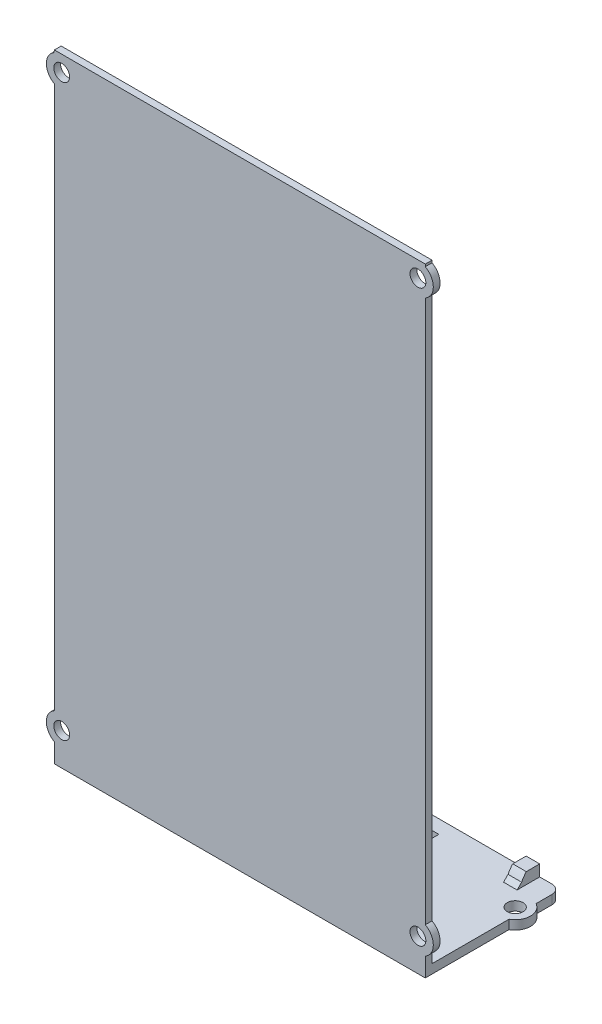
from build123d import *

# Parameters (mm, degrees)
SKETCH1_R                = 1.75
BOSS_EXTRUDE1_DEPTH      = 1.5
BOSS_EXTRUDE2_DEPTH      = 82
BOSS_EXTRUDE3_DEPTH      = 1.5
BOSS_EXTRUDE3_DEPTH_BACK = 1.5
BOSS_EXTRUDE4_DEPTH      = 2
SKETCH5_R                = 1.75
CUT_EXTRUDE1_DEPTH       = 2
CUT_EXTRUDE2_DEPTH       = 149.716477315
CUT_EXTRUDE2_DEPTH_BACK  = 149.716477315
SKETCH6_W                = 82
SKETCH6_H                = 11.5
BOSS_EXTRUDE6_START      = -2
SKETCH7_W                = 3
SKETCH7_H                = 4
BOSS_EXTRUDE6_DEPTH      = 2.5
FILLET1_R                = 2
CHAMFER1_SIZE            = 1
FILLET2_R                = 8
SKETCH8_W                = 26
SKETCH8_H                = 23
CUT_EXTRUDE3_DEPTH       = 22.4262221


with BuildPart() as part:
    # Sketch1 → Boss-Extrude1 (new body)
    with BuildSketch(Plane.XY):
        with BuildLine():
            Line((-37.75, -134.5), (37.75, -134.5))
            Line((37.75, -134.5), (41, -134.5))
            Line((41, -134.5), (41, -132.48653227))
            ThreePointArc((41, -132.48653227), (42.775, -129.5), (41, -126.51346773))
            Line((41, -126.51346773), (41, -6.48653227))
            ThreePointArc((41, -6.48653227), (42.775, -3.5), (41, -0.51346773))
            Line((41, -0.51346773), (41, 0))
            Line((41, 0), (-41, 0))
            Line((-41, 0), (-41.072829787, -0.55426172))
            ThreePointArc((-41.072829787, -0.55426172), (-42.774743802, -3.541738254), (-41, -6.48653227))
            Line((-41, -6.48653227), (-41, -126.51346773))
            ThreePointArc((-41, -126.51346773), (-42.775, -129.5), (-41, -132.48653227))
            Line((-41, -132.48653227), (-41, -134.5))
            Line((-41, -134.5), (-37.75, -134.5))
        make_face()
        with Locations((-39.375, -129.5)):
            Circle(SKETCH1_R, mode=Mode.SUBTRACT)
        with Locations((39.375, -129.5)):
            Circle(SKETCH1_R, mode=Mode.SUBTRACT)
        with Locations((39.375, -3.5)):
            Circle(SKETCH1_R, mode=Mode.SUBTRACT)
        with Locations((-39.375, -3.5)):
            Circle(SKETCH1_R, mode=Mode.SUBTRACT)
    extrude(amount=BOSS_EXTRUDE1_DEPTH)

    # Sketch2 → Boss-Extrude2 (add)
    with BuildSketch(Plane.ZY.offset(41)):
        Polygon((1.5, -134.5), (1.5, -136.7), (-40, -136.7), (-40, -134.7), (0, -134.7), (0, -134.5), (0, -132.48653227), (1.5, -132.48653227), align=None)
    extrude(amount=-BOSS_EXTRUDE2_DEPTH)

    # Sketch3 → Boss-Extrude3 (add, two sides: drawn at the far end of the back side and taken through both)
    with BuildSketch(Plane(origin=(-15, 0, 0), x_dir=(0, 0, -1), z_dir=(1, 0, 0)).offset(-BOSS_EXTRUDE3_DEPTH_BACK)):
        Polygon((0, -119.7), (15, -134.7), (0, -134.7), align=None)
    extrude(amount=BOSS_EXTRUDE3_DEPTH + BOSS_EXTRUDE3_DEPTH_BACK)

    # Sketch4 → Boss-Extrude4 (add)
    with BuildSketch(Plane.XZ.offset(136.7)):
        with BuildLine():
            Line((-41, -17.01346773), (-41, -22.98653227))
            ThreePointArc((-41, -22.98653227), (-42.775, -20), (-41, -17.01346773))
        make_face()
        with BuildLine():
            Line((41, -17.01346773), (41, -22.98653227))
            ThreePointArc((41, -22.98653227), (42.775, -20), (41, -17.01346773))
        make_face()
    extrude(amount=-BOSS_EXTRUDE4_DEPTH)

    # Sketch5 → Cut-Extrude1 (cut)
    with BuildSketch(Plane.XZ.offset(136.7)):
        with Locations(Location((39.375, -20, 0), (0, 0, 270))):
            Circle(SKETCH5_R)
        with Locations(Location((-39.375, -20, 0), (0, 0, 270))):
            Circle(SKETCH5_R)
    extrude(amount=-CUT_EXTRUDE1_DEPTH, mode=Mode.SUBTRACT)

    # Sketch6 → Cut-Extrude2 (cut, two sides: drawn at the far end of the back side and taken through both)
    with BuildSketch(Plane.XZ.offset(136.7).offset(-CUT_EXTRUDE2_DEPTH_BACK)):
        with Locations((0, -34.25)):
            Rectangle(SKETCH6_W, SKETCH6_H)
    extrude(amount=CUT_EXTRUDE2_DEPTH + CUT_EXTRUDE2_DEPTH_BACK, mode=Mode.SUBTRACT)

    # Sketch7 → Boss-Extrude6 (add)
    with BuildSketch(Plane.XZ.offset(136.7).offset(BOSS_EXTRUDE6_START)):
        with Locations((-34.8, -26.5)):
            Rectangle(SKETCH7_W, SKETCH7_H)
        with Locations((34.8, -26.5)):
            Rectangle(SKETCH7_W, SKETCH7_H)
    extrude(amount=-BOSS_EXTRUDE6_DEPTH)

    # Fillet1
    fillet1_edges = [part.edges().sort_by_distance(p)[0] for p in [
        (41, -135.7, -28.5),
        (-41, -135.7, -28.5),
    ]]
    fillet(fillet1_edges, radius=FILLET1_R)

    # Chamfer1
    chamfer1_edges = [part.edges().sort_by_distance(p)[0] for p in [
        (-34.8, -134.7, -24.5),
        (-34.8, -132.2, -24.5),
        (34.8, -134.7, -24.5),
        (34.8, -132.2, -24.5),
    ]]
    chamfer(chamfer1_edges, length=CHAMFER1_SIZE)

    # Fillet2
    # the kernel refuses this fillet: 8 mm, written as the material it takes off along each edge
    with BuildSketch(Plane(origin=(-28.303909917, -133.2, -24.5), x_dir=(0, -1.0, -1.118394266079786e-11), z_dir=(-1, 0, 0))) as fillet2_piece_1:
        with BuildLine():
            CenterArc((4.243746579, -7.06996192), FILLET2_R, 117.902496562, 17.097503438)
            Line((-1.413107671, -1.413107671), (0, 0))
            Line((0, 0), (0.5, 0))
        make_face()
    extrude(amount=12.992180166, mode=Mode.SUBTRACT)
    with BuildSketch(Plane(origin=(28.303909917, -133.2, -24.5), x_dir=(0, 0.7071067811865501, -0.7071067811865448), z_dir=(1, 0, 0))) as fillet2_piece_2:
        with BuildLine():
            CenterArc((1.998436033, -8), FILLET2_R, 90, 17.097503438)
            Line((-0.353553391, -0.353553391), (0, 0))
            Line((0, 0), (1.998436033, 0))
        make_face()
    extrude(amount=12.992180166, mode=Mode.SUBTRACT)

    # Sketch8 → Cut-Extrude3 (cut)
    with BuildSketch(Plane.XZ.offset(136.7)):
        with Locations((4, -14)):
            Rectangle(SKETCH8_W, SKETCH8_H)
    extrude(amount=-CUT_EXTRUDE3_DEPTH, mode=Mode.SUBTRACT)


solid = part.part
